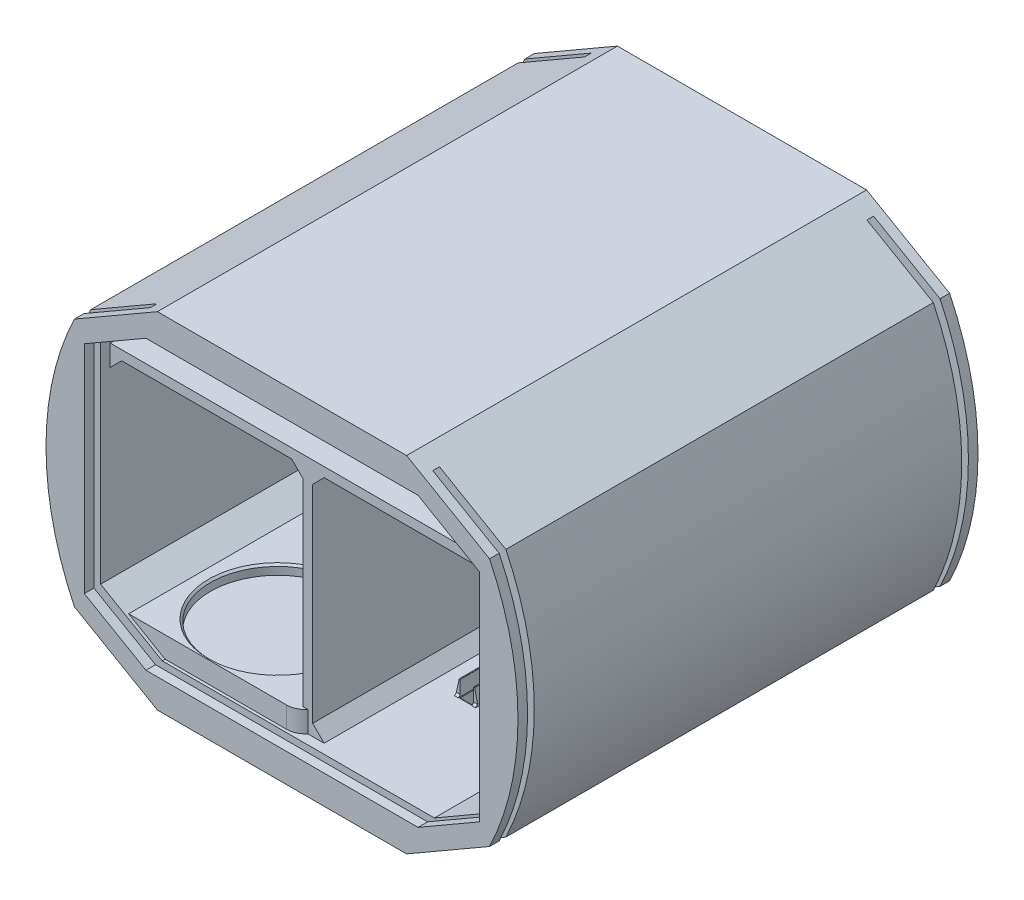
from build123d import *

# Parameters (mm, degrees)
BOSS_EXTRUDE1_DEPTH             = 240
CUT_EXTRUDE4_DEPTH              = 285.354710913
CUT_EXTRUDE4_DEPTH_BACK         = 285.354710913
CUT_EXTRUDE5_DEPTH              = 285.354710913
CUT_EXTRUDE5_DEPTH_BACK         = 285.354710913
SKETCH3_W                       = 3.5
SKETCH3_H                       = 170
BOSS_EXTRUDE4_REACH             = 286.355
SKETCH7_W                       = 213
SKETCH7_H                       = 5
BOSS_EXTRUDE4_DIRECTION_2_REACH = 286.355
CHAMFER7_SIZE                   = 6
SKETCH8_W                       = 5
SKETCH8_H                       = 213
BOSS_EXTRUDE5_DEPTH             = 120
CHAMFER8_SIZE                   = 6
CUT_EXTRUDE6_DEPTH              = 23
CUT_EXTRUDE6_DEPTH_BACK         = 176
SKETCH10_W                      = 25
SKETCH10_H                      = 6
BOSS_EXTRUDE6_DEPTH             = 90
FILLET1_R                       = 10
FILLET2_R                       = 10
SKETCH13_R                      = 2.5
CUT_EXTRUDE7_DEPTH              = 285.354710913
SKETCH14_R                      = 2.5
CUT_EXTRUDE8_DEPTH              = 47
SKETCH15_R                      = 2.5
CUT_EXTRUDE9_DEPTH              = 36
SKETCH16_W                      = 6
SKETCH16_H                      = 100
SKETCH16_W_2                    = 20
SKETCH16_H_2                    = 85
CUT_EXTRUDE10_DEPTH             = 8
SKETCH20_W                      = 2
SKETCH20_H                      = 100
SKETCH20_W_2                    = 1.5
SKETCH20_H_2                    = 85
BOSS_EXTRUDE7_DEPTH             = 8
CUT_EXTRUDE11_REACH             = 230.38
FILLET4_R                       = 0.25
FILLET5_R                       = 1
SKETCH22_W                      = 20
SKETCH22_H                      = 10
CUT_EXTRUDE12_DEPTH             = 43
CHAMFER9_SIZE                   = 1
BOSS_EXTRUDE8_DEPTH             = 8
FILLET6_R                       = 1
FILLET7_R                       = 1
SKETCH25_R                      = 35
CUT_EXTRUDE13_DEPTH             = 5
CUT_EXTRUDE14_START             = -105
SKETCH26_W                      = 25
SKETCH26_H                      = 70
CUT_EXTRUDE14_DEPTH             = 12.5
SKETCH27_W                      = 10
SKETCH27_H                      = 70
BOSS_EXTRUDE9_DEPTH             = 9
FILLET8_R                       = 1
CUT_EXTRUDE15_START             = -30
CUT_EXTRUDE15_DEPTH             = 10
FILLET9_R                       = 1
FILLET10_R                      = 2
CHAMFER10_SIZE                  = 1


with BuildPart() as part:
    # Sketch1 → Boss-Extrude1 (new body)
    with BuildSketch(Plane.XY):
        with BuildLine():
            Line((-65, 90), (-108.301270189, 65))
            ThreePointArc((-108.301270189, 65), (-123.116211843, 0), (-108.301270189, -65))
            Line((-108.301270189, -65), (-65, -90))
            Line((-65, -90), (65, -90))
            Line((65, -90), (108.301270189, -65))
            ThreePointArc((108.301270189, -65), (123.116211843, 0), (108.301270189, 65))
            Line((108.301270189, 65), (65, 90))
            Line((65, 90), (-65, 90))
        make_face()
    extrude(amount=BOSS_EXTRUDE1_DEPTH)

    # Sketch2 → Cut-Extrude4 (cut, two sides: drawn at the far end of the back side and taken through both)
    with BuildSketch(Plane.XY.offset(240).offset(-CUT_EXTRUDE4_DEPTH_BACK)):
        Polygon((-70.980762114, 75), (70.980762114, 75), (103.116211843, 56.446589448), (103.116211843, -56.446589448), (70.980762114, -75), (-70.980762114, -75), (-103.116211843, -56.446589448), (-103.116211843, 56.446589448), align=None)
    extrude(amount=CUT_EXTRUDE4_DEPTH + CUT_EXTRUDE4_DEPTH_BACK, mode=Mode.SUBTRACT)

    # Sketch3 → Cut-Extrude5 (cut, two sides: drawn at the far end of the back side and taken through both)
    with BuildSketch(Plane(origin=(0, 0, 0), x_dir=(0, 0, -1), z_dir=(1, 0, 0)).offset(-CUT_EXTRUDE5_DEPTH_BACK)):
        with Locations((-233.25, 0)):
            Rectangle(SKETCH3_W, SKETCH3_H)
        with Locations((-6.75, 0)):
            Rectangle(SKETCH3_W, SKETCH3_H)
    extrude(amount=CUT_EXTRUDE5_DEPTH + CUT_EXTRUDE5_DEPTH_BACK, mode=Mode.SUBTRACT)

    # Boss-Extrude4: up to this face of the body (flat: up to its plane)
    boss_extrude4_end = Plane(part.part.faces().sort_by_distance((103.116211843, 0, 120))[0])
    # Sketch7 → Boss-Extrude4 (add, up to the picked face)
    with BuildSketch(Plane(origin=(0, 0, 0), x_dir=(0, 0, -1), z_dir=(1, 0, 0)), mode=Mode.PRIVATE) as boss_extrude4_sk1:
        with Locations((-120, 47.5)):
            Rectangle(SKETCH7_W, SKETCH7_H)
    boss_extrude4_tool1 = split(extrude(boss_extrude4_sk1.sketch, amount=BOSS_EXTRUDE4_REACH, mode=Mode.PRIVATE), bisect_by=boss_extrude4_end, keep=Keep.BOTH, mode=Mode.PRIVATE)
    add(boss_extrude4_tool1.solids().sort_by(Axis((0, 47.5, 120), (1, 0, 0)))[0])

    # Boss-Extrude4 direction 2: up to this face of the body (flat: up to its plane)
    boss_extrude4_direction_2_end = Plane(part.part.faces().sort_by_distance((-103.116211843, 0, 120))[0])
    # Sketch7 → Boss-Extrude4 direction 2 (add, up to the picked face)
    with BuildSketch(Plane(origin=(0, 0, 0), x_dir=(0, 0, -1), z_dir=(1, 0, 0)), mode=Mode.PRIVATE) as boss_extrude4_direction_2_sk1:
        with Locations((-120, 47.5)):
            Rectangle(SKETCH7_W, SKETCH7_H)
    boss_extrude4_direction_2_tool1 = split(extrude(boss_extrude4_direction_2_sk1.sketch, amount=-BOSS_EXTRUDE4_DIRECTION_2_REACH, mode=Mode.PRIVATE), bisect_by=boss_extrude4_direction_2_end, keep=Keep.BOTH, mode=Mode.PRIVATE)
    add(boss_extrude4_direction_2_tool1.solids().sort_by(Axis((0, 47.5, 120), (-1, 0, 0)))[0])

    # Chamfer7
    chamfer7_edges = [part.edges().sort_by_distance(p)[0] for p in [
        (-103.116211843, 45, 120),
        (103.116211843, 45, 120),
    ]]
    chamfer(chamfer7_edges, length=CHAMFER7_SIZE)

    # Sketch8 → Boss-Extrude5 (add)
    with BuildSketch(Plane(origin=(0, -75, 0), x_dir=(1, 0, 0), z_dir=(0, 1, 0))):
        with Locations((0, -120)):
            Rectangle(SKETCH8_W, SKETCH8_H)
    extrude(amount=BOSS_EXTRUDE5_DEPTH)

    # Chamfer8
    chamfer8_edges = [part.edges().sort_by_distance(p)[0] for p in [
        (2.5, -75, 120),
        (-2.5, -75, 120),
        (2.5, 45, 120),
        (-2.5, 45, 120),
    ]]
    chamfer(chamfer8_edges, length=CHAMFER8_SIZE)

    # Sketch10 → Cut-Extrude6 (cut, two sides: drawn at the far end of the back side and taken through both)
    with BuildSketch(Plane(origin=(0, 0, 0), x_dir=(0, 0, -1), z_dir=(1, 0, 0)).offset(-CUT_EXTRUDE6_DEPTH_BACK)):
        with Locations((-120, -72)):
            Rectangle(SKETCH10_W, SKETCH10_H)
    extrude(amount=CUT_EXTRUDE6_DEPTH + CUT_EXTRUDE6_DEPTH_BACK, mode=Mode.SUBTRACT)

    # Sketch12 → Boss-Extrude6 (add)
    with BuildSketch(Plane(origin=(0, 0, 0), x_dir=(0, 0, -1), z_dir=(1, 0, 0))):
        Polygon((-10, -64), (-230, -64), (-230, -75), (-132.5, -75), (-132.5, -69), (-107.5, -69), (-107.5, -75), (-10, -75), align=None)
    extrude(amount=-BOSS_EXTRUDE6_DEPTH)

    # Fillet1
    # the kernel refuses this fillet: 10 mm, written as the material it takes off along each edge
    with BuildSketch(Plane(origin=(0, -75, 10), x_dir=(-1, 0, 0), z_dir=(0, 1, 0))) as fillet1_piece_1:
        with BuildLine():
            CenterArc((7.599342077, 10), FILLET1_R, 220.541601874, 49.458398126)
            Line((0, 3.5), (-0.151986842, 3.37))
            ThreePointArc((-0.151986842, 3.37), (-0.2, 1.75), (-0.2, 0))
            Line((-0.2, 0), (0, -0.2))
            Line((0, -0.2), (7.599342077, -0.2))
            Line((7.599342077, -0.2), (7.599342077, 0))
        make_face()
    extrude(amount=29.998355192, mode=Mode.SUBTRACT)

    # Fillet2
    # the kernel refuses this fillet: 10 mm, written as the material it takes off along each edge
    with BuildSketch(Plane(origin=(0, -45.001644808, 230), x_dir=(0, 0, -1), z_dir=(0, -1, 0))) as fillet2_piece_1:
        with BuildLine():
            CenterArc((10, -7.599342077), FILLET2_R, 130.541601874, 49.458398126)
            Line((0, -7.599342077), (-0.2, -7.599342077))
            Line((-0.2, -7.599342077), (-0.2, 0))
            Line((-0.2, 0), (0, 0.2))
            ThreePointArc((0, 0.2), (1.75, 0.2), (3.37, 0.151986842))
            Line((3.37, 0.151986842), (3.5, 0))
        make_face()
    extrude(amount=29.998355192, mode=Mode.SUBTRACT)

    # Sketch13 → Cut-Extrude7 (cut, through all)
    with BuildSketch(Plane(origin=(0, 0, 0), x_dir=(0, 0, -1), z_dir=(1, 0, 0))):
        with Locations((-173.35, 62)):
            Circle(SKETCH13_R)
        with Locations((-66.65, 62)):
            Circle(SKETCH13_R)
        with Locations((-120, 62)):
            Circle(SKETCH13_R)
    extrude(amount=-CUT_EXTRUDE7_DEPTH, mode=Mode.SUBTRACT)

    # Sketch14 → Cut-Extrude8 (cut)
    with BuildSketch(Plane(origin=(0, 50, 0), x_dir=(1, 0, 0), z_dir=(0, 1, 0))):
        with Locations(Location((-52.5, -119.8, 0), (0, 0, 270))):
            Circle(SKETCH14_R)
    extrude(amount=-CUT_EXTRUDE8_DEPTH, mode=Mode.SUBTRACT)

    # Sketch15 → Cut-Extrude9 (cut)
    with BuildSketch(Plane(origin=(-103.116211843, 0, 0), x_dir=(0, 0, -1), z_dir=(1, 0, 0))):
        with Locations(Location((-172.99, 24, 0), (0, 0, 90))):
            Circle(SKETCH15_R)
        with Locations(Location((-67.25, 24, 0), (0, 0, 90))):
            Circle(SKETCH15_R)
    extrude(amount=-CUT_EXTRUDE9_DEPTH, mode=Mode.SUBTRACT)

    # Sketch16 → Cut-Extrude10 (cut)
    with BuildSketch(Plane(origin=(0, -75, 0), x_dir=(1, 0, 0), z_dir=(0, 1, 0))):
        with Locations((26.5, -120)):
            Rectangle(SKETCH16_W, SKETCH16_H)
        with Locations((49.5, -120)):
            Rectangle(SKETCH16_W_2, SKETCH16_H_2)
    extrude(amount=-CUT_EXTRUDE10_DEPTH, mode=Mode.SUBTRACT)

    # Sketch20 → Boss-Extrude7 (add)
    with BuildSketch(Plane(origin=(0, -75, 0), x_dir=(1, 0, 0), z_dir=(0, 1, 0))):
        with Locations((22, -120)):
            Rectangle(SKETCH20_W, SKETCH20_H)
        with Locations((31, -120)):
            Rectangle(SKETCH20_W, SKETCH20_H)
        with Locations((38.25, -120)):
            Rectangle(SKETCH20_W_2, SKETCH20_H_2)
        with Locations((60.75, -120)):
            Rectangle(SKETCH20_W_2, SKETCH20_H_2)
    extrude(amount=BOSS_EXTRUDE7_DEPTH)

    # Sketch21 → Cut-Extrude11 (cut, up to next)
    with BuildSketch(Plane.XY.offset(170), mode=Mode.PRIVATE) as cut_extrude11_sk1:
        Polygon((22.5, -67), (21, -73.754220204), (21, -67), align=None)
    cut_extrude11_tool1 = extrude(cut_extrude11_sk1.sketch, amount=-CUT_EXTRUDE11_REACH, mode=Mode.PRIVATE) & part.part
    # Sketch21 → Cut-Extrude11 (cut, up to next)
    with BuildSketch(Plane.XY.offset(170), mode=Mode.PRIVATE) as cut_extrude11_sk2:
        Polygon((30.5, -67), (32, -67), (32, -73.754220204), align=None)
    cut_extrude11_tool2 = extrude(cut_extrude11_sk2.sketch, amount=-CUT_EXTRUDE11_REACH, mode=Mode.PRIVATE) & part.part
    # Sketch21 → Cut-Extrude11 (cut, up to next)
    with BuildSketch(Plane.XY.offset(170), mode=Mode.PRIVATE) as cut_extrude11_sk3:
        Polygon((38.5, -67), (37.5, -73.754220204), (37.5, -67), align=None)
    cut_extrude11_tool3 = extrude(cut_extrude11_sk3.sketch, amount=-CUT_EXTRUDE11_REACH, mode=Mode.PRIVATE) & part.part
    # Sketch21 → Cut-Extrude11 (cut, up to next)
    with BuildSketch(Plane.XY.offset(170), mode=Mode.PRIVATE) as cut_extrude11_sk4:
        Polygon((60.5, -67), (61.5, -73.754220204), (61.5, -67), align=None)
    cut_extrude11_tool4 = extrude(cut_extrude11_sk4.sketch, amount=-CUT_EXTRUDE11_REACH, mode=Mode.PRIVATE) & part.part
    add(cut_extrude11_tool1.solids().sort_by_distance((21.5, -69.251407, 170))[0], mode=Mode.SUBTRACT)
    add(cut_extrude11_tool2.solids().sort_by_distance((31.5, -69.251407, 170))[0], mode=Mode.SUBTRACT)
    add(cut_extrude11_tool3.solids().sort_by_distance((37.833333, -69.251407, 170))[0], mode=Mode.SUBTRACT)
    add(cut_extrude11_tool4.solids().sort_by_distance((61.166667, -69.251407, 170))[0], mode=Mode.SUBTRACT)

    # Fillet4
    fillet4_edges = [part.edges().sort_by_distance(p)[0] for p in [
        (23, -67, 120),
        (22.75, -67, 70),
        (30, -67, 120),
        (30.25, -67, 170),
        (39, -67, 120),
        (38.75, -67, 77.5),
        (60, -67, 120),
        (60.25, -67, 162.5),
        (60.25, -67, 77.5),
        (38.75, -67, 162.5),
        (30.25, -67, 70),
        (22.75, -67, 170),
        (22.5, -67, 120),
        (30.5, -67, 120),
        (38.5, -67, 120),
        (60.5, -67, 120),
    ]]
    fillet(fillet4_edges, radius=FILLET4_R)

    # Fillet5
    fillet5_edges = [part.edges().sort_by_distance(p)[0] for p in [
        (26.5, -75, 170),
        (26.5, -75, 70),
        (49.5, -75, 162.5),
        (49.5, -75, 77.5),
    ]]
    fillet(fillet5_edges, radius=FILLET5_R)

    # Sketch22 → Cut-Extrude12 (cut)
    with BuildSketch(Plane(origin=(61.5, 0, 0), x_dir=(0, 0, -1), z_dir=(1, 0, 0))):
        with Locations((-120, -70)):
            Rectangle(SKETCH22_W, SKETCH22_H)
    extrude(amount=-CUT_EXTRUDE12_DEPTH, mode=Mode.SUBTRACT)

    # Chamfer9
    chamfer9_edges = [part.edges().sort_by_distance(p)[0] for p in [
        (22, -75, 70),
        (22, -75, 170),
        (31, -75, 170),
        (31, -75, 70),
        (38.25, -75, 162.5),
        (38.25, -75, 77.5),
        (60.75, -75, 77.5),
        (60.75, -75, 162.5),
        (22, -75, 110),
        (31, -75, 110),
        (38.25, -75, 110),
        (60.75, -75, 110),
        (22, -75, 130),
        (31, -75, 130),
        (60.75, -75, 130),
        (38.25, -75, 130),
    ]]
    chamfer(chamfer9_edges, length=CHAMFER9_SIZE)

    # Sketch24 → Boss-Extrude8 (add)
    with BuildSketch(Plane(origin=(0, 50, 0), x_dir=(1, 0, 0), z_dir=(0, 1, 0))):
        with BuildLine():
            Line((-17.917763416, -104), (17.917763416, -104))
            ThreePointArc((17.917763416, -104), (24.66448127, -105.602918295), (29.969274127, -110.069093574))
            Line((29.969274127, -110.069093574), (32.969274127, -110.069093574))
            ThreePointArc((32.969274127, -110.069093574), (26.789760004, -103.436552281), (17.917763416, -101.575188443))
            Line((17.917763416, -101.575188443), (-17.917763416, -101.575188443))
            ThreePointArc((-17.917763416, -101.575188443), (-26.789760004, -103.436552281), (-32.969274127, -110.069093574))
            Line((-32.969274127, -110.069093574), (-29.969274127, -110.069093574))
            ThreePointArc((-29.969274127, -110.069093574), (-24.66448127, -105.602918295), (-17.917763416, -104))
        make_face()
    extrude(amount=BOSS_EXTRUDE8_DEPTH)

    # Fillet6
    fillet6_edges = [part.edges().sort_by_distance(p)[0] for p in [
        (29.969274127, 54, 110.069093574),
        (32.969274127, 54, 110.069093574),
        (-32.969274127, 54, 110.069093574),
        (-29.969274127, 54, 110.069093574),
    ]]
    fillet(fillet6_edges, radius=FILLET6_R)

    # Fillet7
    fillet7_edges = [part.edges().sort_by_distance(p)[0] for p in [
        (24.450244889, 58, 105.497160084),
        (0, 58, 101.575188443),
        (-26.017171128, 58, 103.029743215),
        (0, 58, 104),
        (26.017171128, 58, 103.029743215),
        (30.8728366, 58, 110.069093574),
        (-30.8728366, 58, 110.069093574),
        (-24.450244889, 58, 105.497160084),
        (-30.027267543, 58, 109.969282901),
        (-32.157772318, 58, 109.553459639),
        (30.027267543, 58, 109.969282901),
        (32.157772318, 58, 109.553459639),
    ]]
    fillet(fillet7_edges, radius=FILLET7_R)

    # Sketch25 → Cut-Extrude13 (cut)
    with BuildSketch(Plane(origin=(0, -64, 0), x_dir=(1, 0, 0), z_dir=(0, 1, 0))):
        with Locations(Location((-48.799671038, -46.5, 0), (0, 0, 270))):
            Circle(SKETCH25_R)
        with Locations(Location((-48.799671038, -120, 0), (0, 0, 270))):
            Circle(SKETCH25_R)
        with Locations(Location((-48.799671038, -193.5, 0), (0, 0, 270))):
            Circle(SKETCH25_R)
    extrude(amount=-CUT_EXTRUDE13_DEPTH, mode=Mode.SUBTRACT)

    # Sketch26 → Cut-Extrude14 (cut)
    with BuildSketch(Plane(origin=(0, 50, 0), x_dir=(1, 0, 0), z_dir=(0, 1, 0)).offset(CUT_EXTRUDE14_START)):
        with Locations((86.480762114, -120)):
            Rectangle(SKETCH26_W, SKETCH26_H)
    extrude(amount=-CUT_EXTRUDE14_DEPTH, mode=Mode.SUBTRACT)

    # Sketch27 → Boss-Extrude9 (add)
    with BuildSketch(Plane(origin=(0, -67.5, 0), x_dir=(1, 0, 0), z_dir=(0, 1, 0))):
        with Locations((78.97114317, -120)):
            Rectangle(SKETCH27_W, SKETCH27_H)
    extrude(amount=-BOSS_EXTRUDE9_DEPTH)

    # Fillet8
    fillet8_edges = [part.edges().sort_by_distance(p)[0] for p in [
        (73.97114317, -70.386751346, 155),
        (73.97114317, -70.386751346, 85),
        (78.97114317, -67.5, 85),
        (73.97114317, -67.5, 120),
        (78.97114317, -67.5, 155),
    ]]
    fillet(fillet8_edges, radius=FILLET8_R)

    # Sketch28 → Cut-Extrude15 (cut)
    with BuildSketch(Plane.XY.offset(155).offset(CUT_EXTRUDE15_START)):
        Polygon((73.97114317, -73.273502692), (83.97114317, -67.5), (73.97114317, -67.5), align=None)
    extrude(amount=-CUT_EXTRUDE15_DEPTH, mode=Mode.SUBTRACT)

    # Fillet9
    fillet9_edges = [part.edges().sort_by_distance(p)[0] for p in [
        (74.264036389, -67.792893219, 125),
        (74.264036389, -67.792893219, 115),
        (79.47114317, -67.5, 115),
        (73.97114317, -70.886751346, 115),
        (79.47114317, -67.5, 125),
        (73.97114317, -70.886751346, 125),
    ]]
    fillet(fillet9_edges, radius=FILLET9_R)

    # Fillet10
    fillet10_edges = [part.edges().sort_by_distance(p)[0] for p in [
        (91.475952642, -63.167096231, 85),
        (91.475952642, -63.167096231, 155),
        (98.980762114, -58.834192463, 120),
    ]]
    fillet(fillet10_edges, radius=FILLET10_R)

    # Chamfer10
    chamfer10_edges = [part.edges().sort_by_distance(p)[0] for p in [
        (-48.799671038, -64, 11.5),
        (-48.799671038, -64, 85),
        (-48.799671038, -64, 158.5),
    ]]
    chamfer(chamfer10_edges, length=CHAMFER10_SIZE)


solid = part.part
